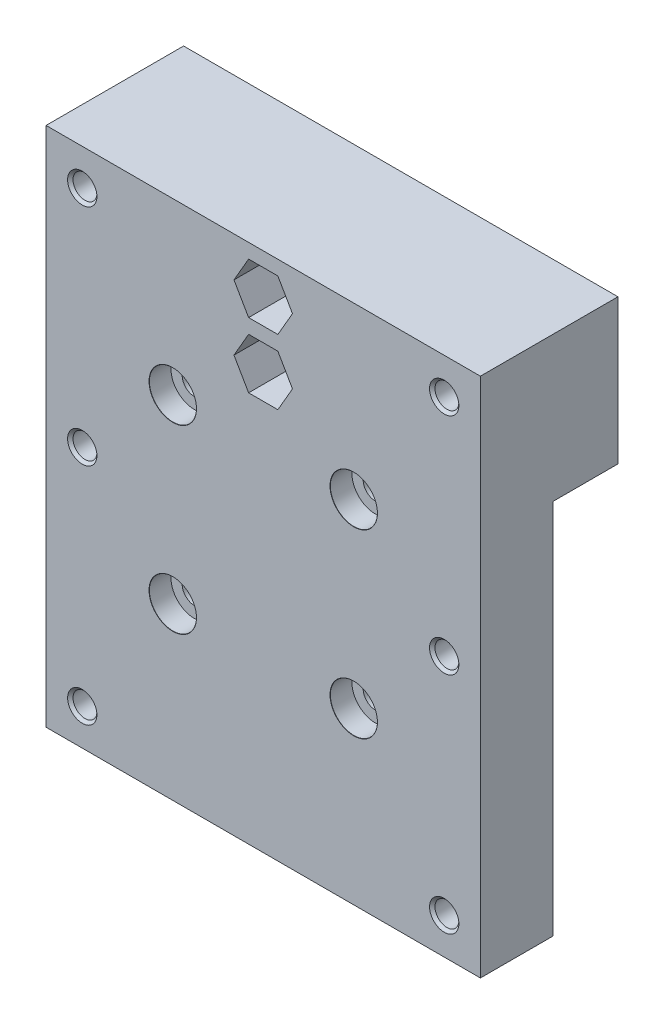
from build123d import *

# Parameters (mm, degrees)
SKETCH2_W                       = 60
SKETCH2_H                       = 72
BOSS_EXTRUDE1_DEPTH             = 10
SKETCH9_W                       = 60
SKETCH9_H                       = 20
BOSS_EXTRUDE2_DEPTH             = 9
CBORE_FOR_M3_SHCS1_AT_2_COUNT   = 2
CBORE_FOR_M3_SHCS1_AT_2_PITCH   = 25
CBORE_FOR_M3_SHCS1_AT_3_COUNT   = 2
CBORE_FOR_M3_SHCS1_AT_3_PITCH   = 35.355339059
CBORE_FOR_M3_SHCS1_AT_4_COUNT   = 2
CBORE_FOR_M3_SHCS1_AT_4_PITCH   = 25
CUT_EXTRUDE1_DEPTH              = 11
SKETCH8_R                       = 2.1
CUT_EXTRUDE2_DEPTH              = 49.135226186
M4X0_7_TAPPED_HOLE1_D           = 3.3
M4X0_7_TAPPED_HOLE1_CSINK_D     = 4.05
M4X0_7_TAPPED_HOLE1_CSINK_ANGLE = 90


with BuildPart() as part:
    # Sketch2 → Boss-Extrude1 (new body)
    with BuildSketch(Plane.XY):
        Rectangle(SKETCH2_W, SKETCH2_H)
    extrude(amount=BOSS_EXTRUDE1_DEPTH)

    # Sketch9 → Boss-Extrude2 (add)
    with BuildSketch(Plane(origin=(0, 0, 0), x_dir=(-1, 0, 0), z_dir=(0, 0, -1))):
        with Locations((0, 26)):
            Rectangle(SKETCH9_W, SKETCH9_H)
    extrude(amount=BOSS_EXTRUDE2_DEPTH)

    # Sketch6 → CBORE for M3 SHCS1 (revolve, cut)
    with BuildSketch(Plane(origin=(-12.5, 12.5, 10), x_dir=(0, -1, 0), z_dir=(1, 0, 0))):
        Polygon((0, 0), (0, 11.021463052), (1.7, 10), (1.7, 3), (3.25, 3), (3.25, 0.025), (3.275, 0), align=None)
    cbore_for_m3_shcs1 = revolve(axis=Axis((-12.5, 12.5, 16.35), (0, 0, -1)), mode=Mode.SUBTRACT)

    # CBORE for M3 SHCS1 at 2: CBORE for M3 SHCS1 ×2
    with Locations(*[(i * CBORE_FOR_M3_SHCS1_AT_2_PITCH, 0, 0) for i in range(1, CBORE_FOR_M3_SHCS1_AT_2_COUNT)]):
        add(cbore_for_m3_shcs1, mode=Mode.SUBTRACT)

    # CBORE for M3 SHCS1 at 3: CBORE for M3 SHCS1 ×2
    with Locations(*[Vector(0.7071067811865477, -0.7071067811865475, 0) * (i * CBORE_FOR_M3_SHCS1_AT_3_PITCH) for i in range(1, CBORE_FOR_M3_SHCS1_AT_3_COUNT)]):
        add(cbore_for_m3_shcs1, mode=Mode.SUBTRACT)

    # CBORE for M3 SHCS1 at 4: CBORE for M3 SHCS1 ×2
    with Locations(*[(0, -i * CBORE_FOR_M3_SHCS1_AT_4_PITCH, 0) for i in range(1, CBORE_FOR_M3_SHCS1_AT_4_COUNT)]):
        add(cbore_for_m3_shcs1, mode=Mode.SUBTRACT)

    # Sketch7 → Cut-Extrude1 (cut)
    with BuildSketch(Plane.XY.offset(10)):
        Polygon((4.041451884, 21.5), (2.020725942, 25), (-2.020725942, 25), (-4.041451884, 21.5), (-2.020725942, 18), (2.020725942, 18), align=None)
        Polygon((4.041451884, 30.5), (2.020725942, 34), (-2.020725942, 34), (-4.041451884, 30.5), (-2.020725942, 27), (2.020725942, 27), align=None)
    extrude(amount=-CUT_EXTRUDE1_DEPTH, mode=Mode.SUBTRACT)

    # Sketch8 → Cut-Extrude2 (cut, through all)
    with BuildSketch(Plane.XY.offset(-1)):
        with Locations((0, 30.5)):
            Circle(SKETCH8_R)
        with Locations((0, 21.5)):
            Circle(SKETCH8_R)
    extrude(amount=-CUT_EXTRUDE2_DEPTH, mode=Mode.SUBTRACT)

    # M4x0.7 Tapped Hole1 (through all)
    with Locations(Plane.XY.offset(10)):
        with Locations((-25, 31), (-25, -31), (25, -31), (25, 31), (-25, 0), (25, 0)):
            CounterSinkHole(M4X0_7_TAPPED_HOLE1_D / 2, M4X0_7_TAPPED_HOLE1_CSINK_D / 2, counter_sink_angle=M4X0_7_TAPPED_HOLE1_CSINK_ANGLE)


solid = part.part
